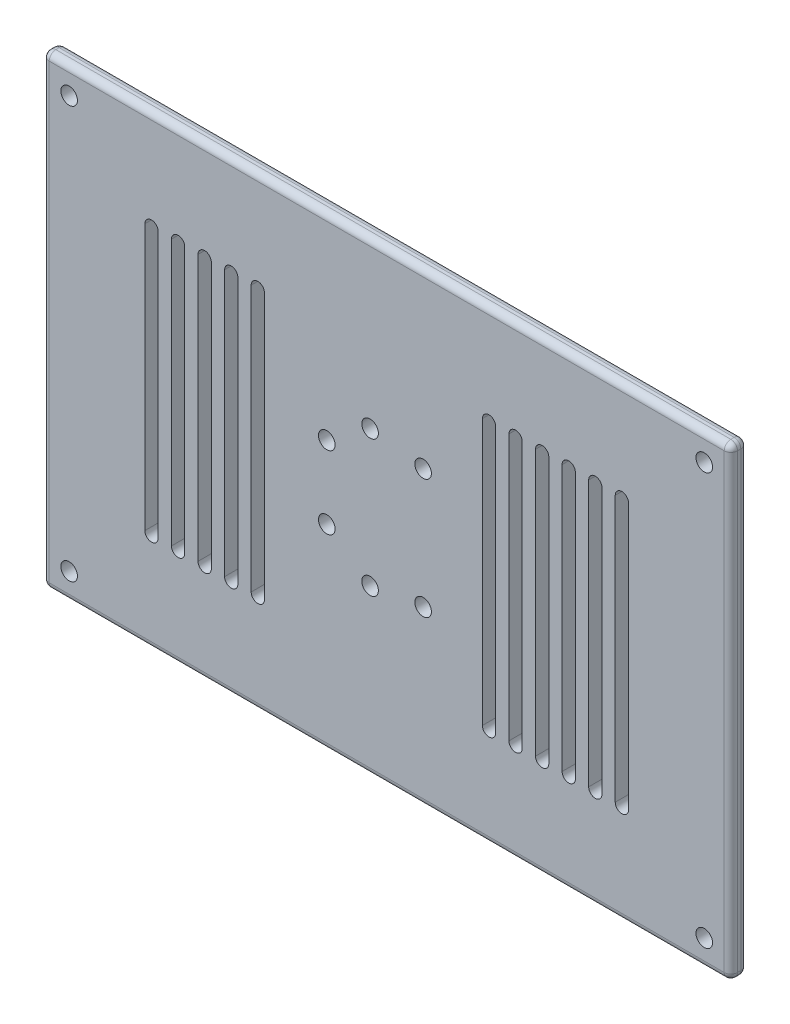
from build123d import *

# Parameters (mm, degrees)
ESQUISSE1_W                                   = 103.6
ESQUISSE1_H                                   = 70
BOSS_EXTRU_1_DEPTH                            = 2.5
CONG_3_R                                      = 1
ESQUISSE17_R                                  = 3
BOSS_EXTRU_12_DEPTH                           = 7
ESQUISSE40_R                                  = 3
BOSS_EXTRU_8_DEPTH                            = 7
ESQUISSE42_R                                  = 3
BOSS_EXTRU_10_DEPTH                           = 7
ENL_V_MAT_EXTRU_2_DEPTH                       = 63.906597428
R_P_TITION_LIN_AIRE1_COUNT                    = 6
R_P_TITION_LIN_AIRE1_PITCH                    = 4
ENL_V_MAT_EXTRU_3_DEPTH                       = 63.906597428
R_P_TITION_LIN_AIRE2_COUNT                    = 5
R_P_TITION_LIN_AIRE2_PITCH                    = 4
TROU_POUR_TARAUDAGE_POUR_TROU_TARAUD_M3_D     = 2.5
TROU_POUR_TARAUDAGE_POUR_TROU_TARAUD_M3_DEPTH = 5
TROU_POUR_TARAUDAGE_POUR_TROU_TARAUD_M3_TIP   = 0.751075774
TROU_POUR_TARAUDAGE_POUR_TROU_TARAUD_2_D      = 2.5
TROU_POUR_TARAUDAGE_POUR_TROU_TARAUD_2_DEPTH  = 5
TROU_POUR_TARAUDAGE_POUR_TROU_TARAUD_2_TIP    = 0.751075774
TROU_POUR_TARAUDAGE_POUR_TROU_TARAUD_3_D      = 2.5
TROU_POUR_TARAUDAGE_POUR_TROU_TARAUD_3_DEPTH  = 5
TROU_POUR_TARAUDAGE_POUR_TROU_TARAUD_3_TIP    = 0.751075774
CONG_4_R                                      = 0.5
TROU_POUR_TARAUDAGE_POUR_TROU_TARAUD_4_D      = 2.5
TROU_POUR_TARAUDAGE_POUR_TROU_TARAUD_4_DEPTH  = 5
TROU_POUR_TARAUDAGE_POUR_TROU_TARAUD_4_TIP    = 0.751075774


with BuildPart() as part:
    # Esquisse1 → Boss.-Extru.1 (new body)
    with BuildSketch(Plane.XY):
        Rectangle(ESQUISSE1_W, ESQUISSE1_H)
    extrude(amount=BOSS_EXTRU_1_DEPTH)

    # Congé3
    cong_3_edges = [part.edges().sort_by_distance(p)[0] for p in [
        (-51.8, 0, 2.5),
        (0, -35, 2.5),
        (0, 35, 2.5),
        (51.8, 0, 2.5),
        (51.8, -35, 1.25),
        (51.8, 35, 1.25),
        (-51.8, 35, 1.25),
        (-51.8, -35, 1.25),
        (51.8, 0, 0),
        (0, 35, 0),
        (-51.8, 0, 0),
        (0, -35, 0),
    ]]
    fillet(cong_3_edges, radius=CONG_3_R)

    # Esquisse17 → Boss.-Extru.12 (add)
    with BuildSketch(Plane.XY.offset(2.5)):
        with Locations((-2.5, 10.25)):
            Circle(ESQUISSE17_R)
        with Locations((-2.5, -10.25)):
            Circle(ESQUISSE17_R)
    extrude(amount=-BOSS_EXTRU_12_DEPTH)

    # Esquisse40 → Boss.-Extru.8 (add)
    with BuildSketch(Plane.XY.offset(2.5)):
        with Locations((5.480077554, -9.01561146)):
            Circle(ESQUISSE40_R)
        with Locations((-9.01561146, 5.480077554)):
            Circle(ESQUISSE40_R)
    extrude(amount=-BOSS_EXTRU_8_DEPTH)

    # Esquisse42 → Boss.-Extru.10 (add)
    with BuildSketch(Plane.XY.offset(2.5)):
        with Locations((-9.01561146, -5.480077554)):
            Circle(ESQUISSE42_R)
        with Locations((5.480077554, 9.01561146)):
            Circle(ESQUISSE42_R)
    extrude(amount=-BOSS_EXTRU_10_DEPTH)

    # Esquisse36 → Enlèv. mat.-Extru.2 (cut, through all)
    with BuildSketch(Plane.XY.offset(2.5)):
        with BuildLine():
            Line((36.4, 20), (36.4, -20))
            ThreePointArc((36.4, -20), (35.4, -21), (34.4, -20))
            Line((34.4, -20), (34.4, 20))
            ThreePointArc((34.4, 20), (35.4, 21), (36.4, 20))
        make_face()
    enl_v_mat_extru_2 = extrude(amount=-ENL_V_MAT_EXTRU_2_DEPTH, mode=Mode.SUBTRACT)

    # Répétition linéaire1: Enlèv. mat.-Extru.2 ×6
    with Locations(*[(-i * R_P_TITION_LIN_AIRE1_PITCH, 0, 0) for i in range(1, R_P_TITION_LIN_AIRE1_COUNT)]):
        add(enl_v_mat_extru_2, mode=Mode.SUBTRACT)

    # Esquisse37 → Enlèv. mat.-Extru.3 (cut, through all)
    with BuildSketch(Plane.XY.offset(2.5)):
        with BuildLine():
            Line((-34.4, 20), (-34.4, -20))
            ThreePointArc((-34.4, -20), (-35.4, -21), (-36.4, -20))
            Line((-36.4, -20), (-36.4, 20))
            ThreePointArc((-36.4, 20), (-35.4, 21), (-34.4, 20))
        make_face()
    enl_v_mat_extru_3 = extrude(amount=-ENL_V_MAT_EXTRU_3_DEPTH, mode=Mode.SUBTRACT)

    # Répétition linéaire2: Enlèv. mat.-Extru.3 ×5
    with Locations(*[(i * R_P_TITION_LIN_AIRE2_PITCH, 0, 0) for i in range(1, R_P_TITION_LIN_AIRE2_COUNT)]):
        add(enl_v_mat_extru_3, mode=Mode.SUBTRACT)

    # Trou pour taraudage pour trou taraud_ M3
    with Locations(Plane(origin=(5.480077554, -9.01561146, 2.5), x_dir=(1, 0, 0), z_dir=(0, 0, 1))):
        with Locations((0, 0), (-14.495689014, 14.495689014)):
            Hole(TROU_POUR_TARAUDAGE_POUR_TROU_TARAUD_M3_D / 2, depth=TROU_POUR_TARAUDAGE_POUR_TROU_TARAUD_M3_DEPTH)
            with Locations((0, 0, -(TROU_POUR_TARAUDAGE_POUR_TROU_TARAUD_M3_DEPTH + TROU_POUR_TARAUDAGE_POUR_TROU_TARAUD_M3_TIP / 2))):  # 118° drill point
                Cone(0, TROU_POUR_TARAUDAGE_POUR_TROU_TARAUD_M3_D / 2, TROU_POUR_TARAUDAGE_POUR_TROU_TARAUD_M3_TIP, mode=Mode.SUBTRACT)

    # Trou pour taraudage pour trou taraud 2
    with Locations(Plane(origin=(5.480077554, 9.01561146, 2.5), x_dir=(1, 0, 0), z_dir=(0, 0, 1))):
        with Locations((0, 0), (-14.495689014, -14.495689014)):
            Hole(TROU_POUR_TARAUDAGE_POUR_TROU_TARAUD_2_D / 2, depth=TROU_POUR_TARAUDAGE_POUR_TROU_TARAUD_2_DEPTH)
            with Locations((0, 0, -(TROU_POUR_TARAUDAGE_POUR_TROU_TARAUD_2_DEPTH + TROU_POUR_TARAUDAGE_POUR_TROU_TARAUD_2_TIP / 2))):  # 118° drill point
                Cone(0, TROU_POUR_TARAUDAGE_POUR_TROU_TARAUD_2_D / 2, TROU_POUR_TARAUDAGE_POUR_TROU_TARAUD_2_TIP, mode=Mode.SUBTRACT)

    # Trou pour taraudage pour trou taraud 3
    with Locations(Plane(origin=(-2.5, 10.25, 2.5), x_dir=(1, 0, 0), z_dir=(0, 0, 1))):
        with Locations((0, 0), (0, -20.5)):
            Hole(TROU_POUR_TARAUDAGE_POUR_TROU_TARAUD_3_D / 2, depth=TROU_POUR_TARAUDAGE_POUR_TROU_TARAUD_3_DEPTH)
            with Locations((0, 0, -(TROU_POUR_TARAUDAGE_POUR_TROU_TARAUD_3_DEPTH + TROU_POUR_TARAUDAGE_POUR_TROU_TARAUD_3_TIP / 2))):  # 118° drill point
                Cone(0, TROU_POUR_TARAUDAGE_POUR_TROU_TARAUD_3_D / 2, TROU_POUR_TARAUDAGE_POUR_TROU_TARAUD_3_TIP, mode=Mode.SUBTRACT)

    # Congé4
    cong_4_edges = [part.edges().sort_by_distance(p)[0] for p in [
        (-5.5, -10.25, 0),
        (-5.5, -10.25, -4.5),
        (-5.5, 10.25, 0),
        (-5.5, 10.25, -4.5),
        (2.480077554, -9.01561146, -4.5),
        (2.480077554, 9.01561146, -4.5),
        (-12.01561146, 5.480077554, 0),
        (-12.01561146, 5.480077554, -4.5),
        (-12.01561146, -5.480077554, 0),
        (-12.01561146, -5.480077554, -4.5),
        (2.480077554, 9.01561146, 0),
        (2.480077554, -9.01561146, 0),
    ]]
    fillet(cong_4_edges, radius=CONG_4_R)

    # Trou pour taraudage pour trou taraud 4
    with Locations(Plane(origin=(-47.8, 31, 2.5), x_dir=(1, 0, 0), z_dir=(0, 0, 1))):
        with Locations((0, 0), (0, -62), (95.6, -62), (95.6, 0)):
            Hole(TROU_POUR_TARAUDAGE_POUR_TROU_TARAUD_4_D / 2, depth=TROU_POUR_TARAUDAGE_POUR_TROU_TARAUD_4_DEPTH)
            with Locations((0, 0, -(TROU_POUR_TARAUDAGE_POUR_TROU_TARAUD_4_DEPTH + TROU_POUR_TARAUDAGE_POUR_TROU_TARAUD_4_TIP / 2))):  # 118° drill point
                Cone(0, TROU_POUR_TARAUDAGE_POUR_TROU_TARAUD_4_D / 2, TROU_POUR_TARAUDAGE_POUR_TROU_TARAUD_4_TIP, mode=Mode.SUBTRACT)


solid = part.part
